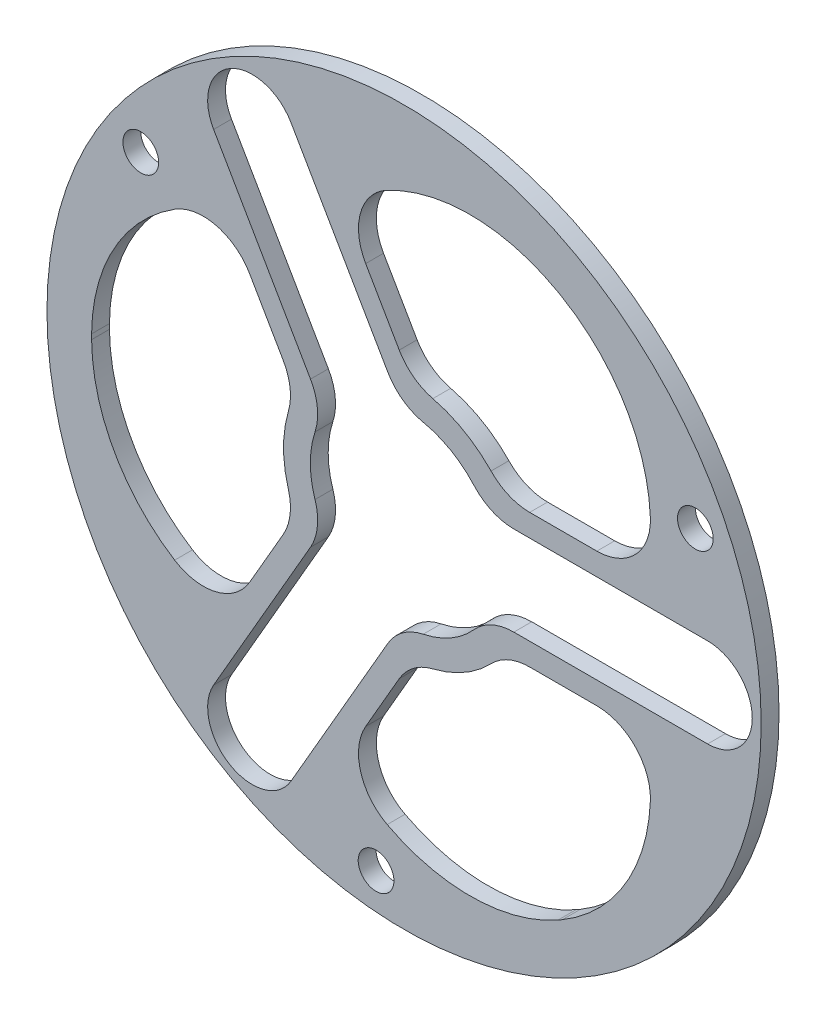
from build123d import *

# Parameters (mm, degrees)
SKETCH1_R                = 40
SKETCH1_R_2              = 35
BOSS_EXTRUDE1_DEPTH      = 2
BOSS_EXTRUDE2_DEPTH      = 2
SKETCH3_R                = 3
CUT_EXTRUDE1_DEPTH       = 2
FILLET1_DEPTH            = 2
SKETCH4_R                = 2
CUT_EXTRUDE2_DEPTH       = 10
BOSS_EXTRUDE3_START      = -2
BOSS_EXTRUDE3_DEPTH      = 2
BOSS_EXTRUDE4_START      = -2
SKETCH7_R                = 13.5
SKETCH7_R_2              = 10.5
BOSS_EXTRUDE4_DEPTH      = 2
FILLET2_R                = 6
CUT_EXTRUDE3_DEPTH       = 3
CIRPATTERN1_COUNT        = 3
FILLET2_OF_CIRPATTERN1_R = 6
FILLET3_R                = 6


with BuildPart() as part:
    # Sketch1 → Boss-Extrude1 (new body)
    with BuildSketch(Plane.XY):
        Circle(SKETCH1_R)
        Circle(SKETCH1_R_2, mode=Mode.SUBTRACT)
    extrude(amount=BOSS_EXTRUDE1_DEPTH)

    # Sketch2 → Boss-Extrude2 (add)
    with BuildSketch(Plane(origin=(0, 0, 0), x_dir=(-1, 0, 0), z_dir=(0, 0, -1))):
        with BuildLine():
            Line((-29, 5), (-34.641016151, 5))
            Line((-34.641016151, 5), (-37.165171868, 5))
            ThreePointArc((-37.165171868, 5), (-37.5, 0), (-37.165171868, -5))
            Line((-37.165171868, -5), (-29, -5))
            ThreePointArc((-29, -5), (-24, 0), (-29, 5))
        make_face()
        with BuildLine():
            Line((-34, -3), (-29, -3))
            ThreePointArc((-29, -3), (-26, 0), (-29, 3))
            Line((-29, 3), (-34, 3))
            ThreePointArc((-34, 3), (-37, 0), (-34, -3))
        make_face(mode=Mode.SUBTRACT)
    boss_extrude2 = extrude(amount=-BOSS_EXTRUDE2_DEPTH)

    # Sketch3 → Cut-Extrude1 (cut)
    with BuildSketch(Plane(origin=(0, 0, 0), x_dir=(-1, 0, 0), z_dir=(0, 0, -1))):
        with Locations((-34, 0)):
            Circle(SKETCH3_R)
    cut_extrude1 = extrude(amount=-CUT_EXTRUDE1_DEPTH, mode=Mode.SUBTRACT)

    # Fillet1: read off the stored shape, not the designer's step
    # Fillet1 outline → Fillet1 (add)
    with BuildSketch(Plane.XY):
        with BuildLine():
            ThreePointArc((29, -5), (26.543386825, -4.354888254), (24.720689655, -2.586020683))
            ThreePointArc((24.720689655, -2.586020683), (26.992450638, -17.835874241), (17.74137931, -30.170241301))
            ThreePointArc((17.74137931, -30.170241301), (29.057943842, -19.509892353), (34.641016151, -5))
            Line((34.641016151, -5), (29, -5))
        make_face()
        with BuildLine():
            ThreePointArc((17.74137931, 30.170241301), (26.992450638, 17.835874241), (24.720689655, 2.586020683))
            ThreePointArc((24.720689655, 2.586020683), (26.543386825, 4.354888254), (29, 5))
            Line((29, 5), (34.641016151, 5))
            ThreePointArc((34.641016151, 5), (29.057943842, 19.509892353), (17.74137931, 30.170241301))
        make_face()
    fillet1 = extrude(amount=FILLET1_DEPTH)

    # Sketch4 → Cut-Extrude2 (cut)
    with BuildSketch(Plane.XY.offset(2)):
        with Locations((32.627080333, 15.214257423)):
            Circle(SKETCH4_R)
    cut_extrude2 = extrude(amount=-CUT_EXTRUDE2_DEPTH, mode=Mode.SUBTRACT)

    # Sketch5 → Boss-Extrude3 (add)
    with BuildSketch(Plane.XY.offset(2).offset(BOSS_EXTRUDE3_START)):
        with BuildLine():
            Line((7.348469228, 7.5), (34.186985828, 7.5))
            ThreePointArc((34.186985828, 7.5), (34.60231879, 5.261134323), (34.871191548, 3))
            Line((34.871191548, 3), (29, 3))
            ThreePointArc((29, 3), (26, 0), (29, -3))
            Line((29, -3), (34.871191548, -3))
            ThreePointArc((34.871191548, -3), (34.60231879, -5.261134323), (34.186985828, -7.5))
            Line((34.186985828, -7.5), (7.348469228, -7.5))
            ThreePointArc((7.348469228, -7.5), (10.5, 0), (7.348469228, 7.5))
        make_face()
    boss_extrude3 = extrude(amount=BOSS_EXTRUDE3_DEPTH)

    # Sketch7 → Boss-Extrude4 (add)
    with BuildSketch(Plane.XY.offset(2).offset(BOSS_EXTRUDE4_START)):
        Circle(SKETCH7_R)
        with Locations(Location((0, 0, 0), (0, 0, 180))):
            Circle(SKETCH7_R_2, mode=Mode.SUBTRACT)
    extrude(amount=BOSS_EXTRUDE4_DEPTH)

    # Fillet2
    fillet2_edges = [part.edges().sort_by_distance(p)[0] for p in [
        (11.22497216, 7.5, 1),
        (11.22497216, -7.5, 1),
        (26.852187894, 7.5, 1),
        (26.852187894, -7.5, 1),
    ]]
    fillet(fillet2_edges, radius=FILLET2_R)

    # Sketch6 → Cut-Extrude3 (cut)
    with BuildSketch(Plane.XY.offset(2)):
        with BuildLine():
            Line((0, 5), (34, 5))
            ThreePointArc((34, 5), (39, 0), (34, -5))
            Line((34, -5), (0, -5))
            Line((0, -5), (0, 5))
        make_face()
    cut_extrude3 = extrude(amount=-CUT_EXTRUDE3_DEPTH, mode=Mode.SUBTRACT)

    # CirPattern1: Boss-Extrude2, Cut-Extrude1, Fillet1, Cut-Extrude2, Boss-Extrude3, Cut-Extrude3 ×3 about axis
    cirpattern1_axis = Axis((0, 0, 0), (0, 0, 1))
    add([boss_extrude2.rotate(cirpattern1_axis, i * 360 / CIRPATTERN1_COUNT) for i in range(1, CIRPATTERN1_COUNT)])
    add([cut_extrude1.rotate(cirpattern1_axis, i * 360 / CIRPATTERN1_COUNT) for i in range(1, CIRPATTERN1_COUNT)], mode=Mode.SUBTRACT)
    add([fillet1.rotate(cirpattern1_axis, i * 360 / CIRPATTERN1_COUNT) for i in range(1, CIRPATTERN1_COUNT)])
    add([cut_extrude2.rotate(cirpattern1_axis, i * 360 / CIRPATTERN1_COUNT) for i in range(1, CIRPATTERN1_COUNT)], mode=Mode.SUBTRACT)
    add([boss_extrude3.rotate(cirpattern1_axis, i * 360 / CIRPATTERN1_COUNT) for i in range(1, CIRPATTERN1_COUNT)])
    add([cut_extrude3.rotate(cirpattern1_axis, i * 360 / CIRPATTERN1_COUNT) for i in range(1, CIRPATTERN1_COUNT)], mode=Mode.SUBTRACT)

    # Fillet2 of CirPattern1
    fillet2_of_cirpattern1_edges = [part.edges().sort_by_distance(p)[0] for p in [
        (-12.107676609, 5.971111048, 1),
        (0.882704448, 13.471111048, 1),
        (-19.921284476, 19.504676864, 1),
        (-6.930903419, 27.004676864, 1),
        (0.882704448, -13.471111048, 1),
        (-12.107676609, -5.971111048, 1),
        (-6.930903419, -27.004676864, 1),
        (-19.921284476, -19.504676864, 1),
    ]]
    fillet(fillet2_of_cirpattern1_edges, radius=FILLET2_OF_CIRPATTERN1_R)

    # Fillet3
    fillet3_edges = [part.edges().sort_by_distance(p)[0] for p in [
        (9.233092656, -5, 1),
        (9.233092656, 5, 1),
        (-0.286419309, 10.496092796, 1),
        (-8.946673347, 5.496092796, 1),
        (-8.946673347, -5.496092796, 1),
        (-0.286419309, -10.496092796, 1),
    ]]
    fillet(fillet3_edges, radius=FILLET3_R)


solid = part.part
